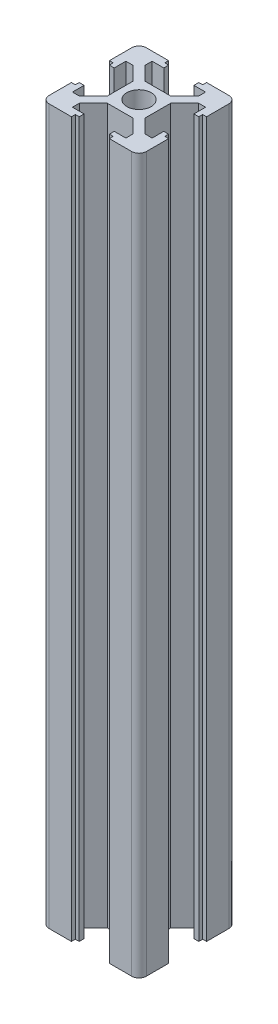
from build123d import *

# Parameters (mm, degrees)
BOSS_EXTRUDE1_DEPTH = 147


with BuildPart() as part:
    # Sketch1 → Boss-Extrude1 (new body)
    with BuildSketch(Plane(origin=(0, 0, 0), x_dir=(1, 0, 0), z_dir=(0, 1, 0))):
        with BuildLine():
            Line((8.5, 10), (3.9, 10))
            Line((3.9, 10), (3.9, 9.2))
            Line((3.9, 9.2), (3.1, 9.2))
            Line((3.1, 9.2), (3.1, 8.2))
            Line((3.1, 8.2), (5.5, 8.2))
            Line((5.5, 8.2), (5.5, 6.77))
            Line((5.5, 6.77), (2.63, 3.9))
            Line((2.63, 3.9), (2.549104946, 3.9))
            Line((2.549104946, 3.9), (0, 3.9))
            Line((0, 3.9), (-2.63, 3.9))
            Line((-2.63, 3.9), (-5.5, 6.77))
            Line((-5.5, 6.77), (-5.5, 8.2))
            Line((-5.5, 8.2), (-3.1, 8.2))
            Line((-3.1, 8.2), (-3.1, 9.2))
            Line((-3.1, 9.2), (-3.9, 9.2))
            Line((-3.9, 9.2), (-3.9, 10))
            Line((-3.9, 10), (-8.5, 10))
            ThreePointArc((-8.5, 10), (-9.560660172, 9.560660172), (-10, 8.5))
            Line((-10, 8.5), (-10, 3.9))
            Line((-10, 3.9), (-9.2, 3.9))
            Line((-9.2, 3.9), (-9.2, 3.1))
            Line((-9.2, 3.1), (-8.2, 3.1))
            Line((-8.2, 3.1), (-8.2, 5.5))
            Line((-8.2, 5.5), (-6.77, 5.5))
            Line((-6.77, 5.5), (-3.9, 2.63))
            Line((-3.9, 2.63), (-3.9, 0))
            Line((-3.9, 0), (-3.9, -2.63))
            Line((-3.9, -2.63), (-6.77, -5.5))
            Line((-6.77, -5.5), (-8.2, -5.5))
            Line((-8.2, -5.5), (-8.2, -3.1))
            Line((-8.2, -3.1), (-9.2, -3.1))
            Line((-9.2, -3.1), (-9.2, -3.9))
            Line((-9.2, -3.9), (-10, -3.9))
            Line((-10, -3.9), (-10, -8.5))
            ThreePointArc((-10, -8.5), (-9.560660172, -9.560660172), (-8.5, -10))
            Line((-8.5, -10), (-3.9, -10))
            Line((-3.9, -10), (-3.9, -9.2))
            Line((-3.9, -9.2), (-3.1, -9.2))
            Line((-3.1, -9.2), (-3.1, -8.2))
            Line((-3.1, -8.2), (-5.5, -8.2))
            Line((-5.5, -8.2), (-5.5, -6.77))
            Line((-5.5, -6.77), (-2.63, -3.9))
            Line((-2.63, -3.9), (0, -3.9))
            Line((0, -3.9), (2.63, -3.9))
            Line((2.63, -3.9), (5.5, -6.77))
            Line((5.5, -6.77), (5.5, -8.2))
            Line((5.5, -8.2), (3.1, -8.2))
            Line((3.1, -8.2), (3.1, -9.2))
            Line((3.1, -9.2), (3.9, -9.2))
            Line((3.9, -9.2), (3.9, -10))
            Line((3.9, -10), (8.5, -10))
            ThreePointArc((8.5, -10), (9.560660172, -9.560660172), (10, -8.5))
            Line((10, -8.5), (10, -3.9))
            Line((10, -3.9), (9.2, -3.9))
            Line((9.2, -3.9), (9.2, -3.1))
            Line((9.2, -3.1), (8.2, -3.1))
            Line((8.2, -3.1), (8.2, -5.5))
            Line((8.2, -5.5), (6.77, -5.5))
            Line((6.77, -5.5), (3.9, -2.63))
            Line((3.9, -2.63), (3.9, 0))
            Line((3.9, 0), (3.9, 2.63))
            Line((3.9, 2.63), (6.77, 5.5))
            Line((6.77, 5.5), (8.2, 5.5))
            Line((8.2, 5.5), (8.2, 3.1))
            Line((8.2, 3.1), (9.2, 3.1))
            Line((9.2, 3.1), (9.2, 3.9))
            Line((9.2, 3.9), (10, 3.9))
            Line((10, 3.9), (10, 8.5))
            ThreePointArc((10, 8.5), (9.560660172, 9.560660172), (8.5, 10))
        make_face()
        with BuildLine():
            ThreePointArc((0, 2.5), (1.767766953, 1.767766953), (2.5, 0))
            ThreePointArc((2.5, 0), (-1.767766953, -1.767766953), (0, 2.5))
        make_face(mode=Mode.SUBTRACT)
    extrude(amount=BOSS_EXTRUDE1_DEPTH)


solid = part.part
